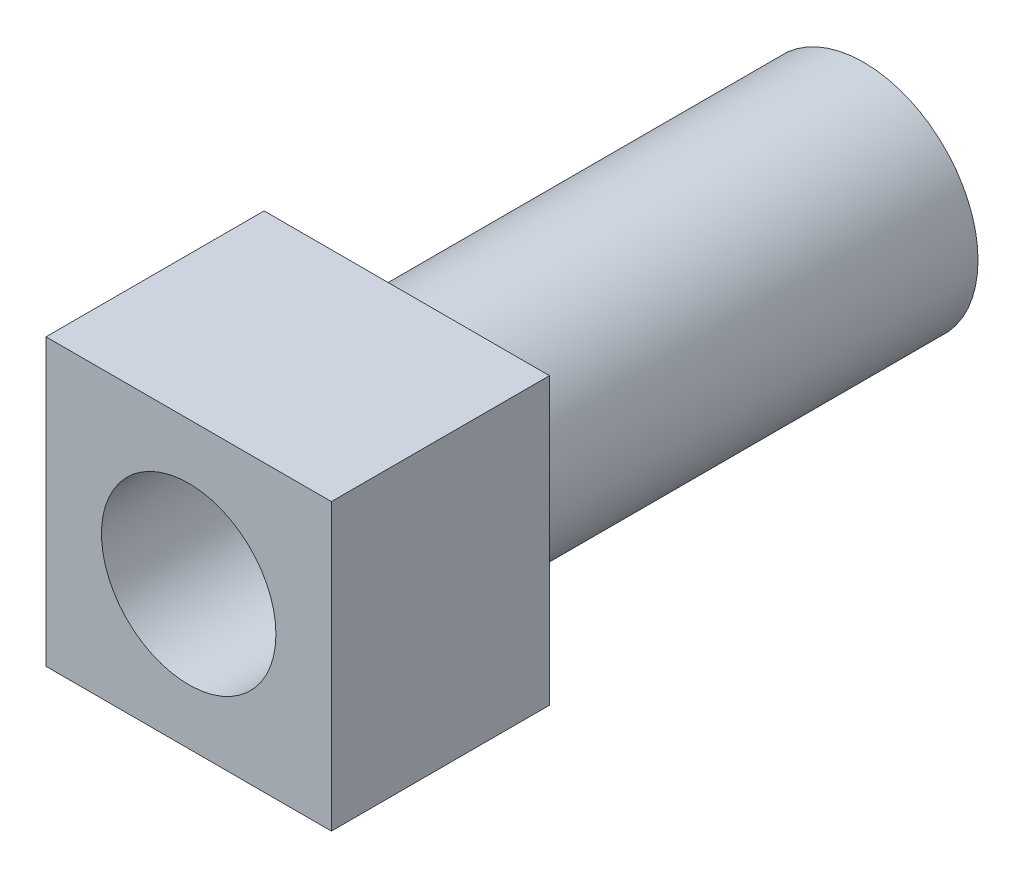
from build123d import *

# Parameters (mm, degrees)
ESQUISSE1_W             = 13.74
ESQUISSE1_H             = 13.74
BOSS_EXTRU_1_DEPTH      = 10.5
ESQUISSE3_R             = 4.2
ENL_V_MAT_EXTRU_2_DEPTH = 10
ESQUISSE2_R             = 2.49
BOSS_EXTRU_4_DEPTH      = 22
ENL_V_START             = -22
ENL_V_MAT_EXTRU_4_DEPTH = 22
ESQUISSE6_R             = 5.5
ESQUISSE6_R_2           = 2.49
BOSS_EXTRU_5_DEPTH      = 22


with BuildPart() as part:
    # Esquisse1 → Boss.-Extru.1 (new body)
    with BuildSketch(Plane.XY):
        with Locations((-30.186071131, 8.6104)):
            Rectangle(ESQUISSE1_W, ESQUISSE1_H)
    extrude(amount=BOSS_EXTRU_1_DEPTH)

    # Esquisse3 → Enlèv. mat.-Extru.2 (cut)
    with BuildSketch(Plane.XY.offset(10.5)):
        with Locations((-30.186071131, 8.6104)):
            Circle(ESQUISSE3_R)
    extrude(amount=-ENL_V_MAT_EXTRU_2_DEPTH, mode=Mode.SUBTRACT)

    # Esquisse2 → Boss.-Extru.4 (add)
    with BuildSketch(Plane(origin=(0, 0, 0), x_dir=(-1, 0, 0), z_dir=(0, 0, -1))):
        with Locations((30.186071131, 8.6104)):
            Circle(ESQUISSE2_R)
    extrude(amount=BOSS_EXTRU_4_DEPTH)

    # Esquisse5 → Enlèv. mat.-Extru.4 (cut)
    with BuildSketch(Plane(origin=(0, 0, -22), x_dir=(-1, 0, 0), z_dir=(0, 0, -1)).offset(ENL_V_START)):
        with BuildLine():
            Line((29.625790006, 11.036546134), (27.696071131, 8.6104))
            ThreePointArc((27.696071131, 8.6104), (30.186071131, 6.1204), (32.676071131, 8.6104))
            ThreePointArc((32.676071131, 8.6104), (31.736071131, 10.559143185), (29.625790006, 11.036546134))
        make_face()
    extrude(amount=ENL_V_MAT_EXTRU_4_DEPTH, mode=Mode.SUBTRACT)

    # Esquisse6 → Boss.-Extru.5 (add)
    with BuildSketch(Plane(origin=(0, 0, 0), x_dir=(-1, 0, 0), z_dir=(0, 0, -1))):
        with Locations((30.186071131, 8.6104)):
            Circle(ESQUISSE6_R)
        with Locations((30.186071131, 8.6104)):
            Circle(ESQUISSE6_R_2, mode=Mode.SUBTRACT)
    extrude(amount=BOSS_EXTRU_5_DEPTH)


solid = part.part
